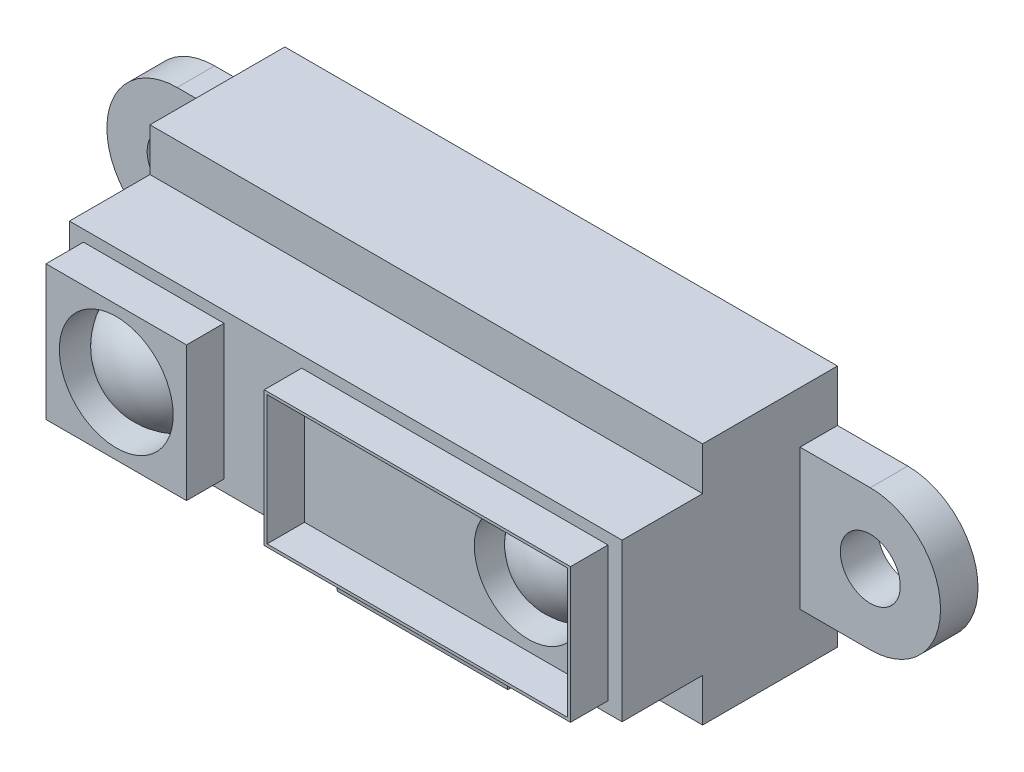
from build123d import *

# Parameters (mm, degrees)
ESTRUSIONE_ESTRUSIONE1_DEPTH = 4.5
NERVATURA1_START             = -4.55
NERVATURA1_DEPTH             = 9.1
ESTRUSIONE_ESTRUSIONE2_DEPTH = 7
TAGLIO_ESTRUSIONE1_DEPTH     = 3.3
ESTRUSIONE_ESTRUSIONE3_DEPTH = 2
FORO1_D                      = 3.2
FORO2_D                      = 3.2
SCHIZZO10_W                  = 29.5
SCHIZZO10_H                  = 2.3
SCHIZZO10_W_2                = 9.7
TAGLIO_ESTRUSIONE2_DEPTH     = 4.3
SCHIZZO11_W                  = 16.35
SCHIZZO11_H                  = 7.2
SCHIZZO11_W_2                = 16.05
SCHIZZO11_H_2                = 6.904461538
ESTRUSIONE_ESTRUSIONE4_DEPTH = 2
SCHIZZO12_R                  = 2.885572668
TAGLIO_ESTRUSIONE3_DEPTH     = 2
SCHIZZO15_W                  = 7.5
SCHIZZO15_H                  = 7.2
SCHIZZO15_R                  = 3.038054308
ESTRUSIONE_ESTRUSIONE5_DEPTH = 2


# Read off the part's stored shape, not the designer's step: Nervatura1
with BuildPart() as part:
    # Schizzo1 → Estrusione-Estrusione1 (new body)
    with BuildSketch(Plane.XY.offset(4.5)):
        Polygon((5.05, -9.992575631), (5.05, -6.5), (14.75, -6.5), (14.75, 6.5), (-14.75, 6.5), (-14.75, -6.5), (-5.05, -6.5), (-5.05, -9.992575631), align=None)
    extrude(amount=-ESTRUSIONE_ESTRUSIONE1_DEPTH)

    # Nervatura1 outline → Nervatura1 (add)
    with BuildSketch(Plane.YZ.offset(NERVATURA1_START)):
        Polygon((-4.296088186, 4.5), (-5.110000145, 7.951589572), (-9.866118458, 7.398410428), (-9.866118458, 4.5), align=None)
    extrude(amount=NERVATURA1_DEPTH)

    # Schizzo3 → Estrusione-Estrusione2 (add)
    with BuildSketch(Plane.XY.offset(4.5)):
        Polygon((-14.75, -6.5), (-14.75, 6.5), (14.75, 6.5), (14.75, -6.5), (5.05, -6.5), (5.05, -4.2), (-5.05, -4.2), (-5.05, -6.5), align=None)
    extrude(amount=ESTRUSIONE_ESTRUSIONE2_DEPTH)

    # Schizzo4 → Taglio-Estrusione1 (cut)
    with BuildSketch(Plane(origin=(0, 0, 0), x_dir=(-1, 0, 0), z_dir=(0, 0, -1))):
        Polygon((5.05, -9.992575631), (5.05, -6.5), (5.05, -6), (14.25, -6), (14.25, 6), (-14.25, 6), (-14.25, -6), (-5.05, -6), (-5.05, -6.5), (-5.05, -9.992575631), align=None)
    extrude(amount=-TAGLIO_ESTRUSIONE1_DEPTH, mode=Mode.SUBTRACT)

    # Schizzo5 → Estrusione-Estrusione3 (add)
    with BuildSketch(Plane(origin=(0, 0, 0), x_dir=(-1, 0, 0), z_dir=(0, 0, -1))):
        with BuildLine():
            Line((14.75, 3.75), (14.75, -3.75))
            Line((14.75, -3.75), (18.5, -3.75))
            ThreePointArc((18.5, -3.75), (22.25, 0), (18.5, 3.75))
            Line((18.5, 3.75), (14.75, 3.75))
        make_face()
        with BuildLine():
            Line((-14.75, -3.75), (-14.75, 3.75))
            Line((-14.75, 3.75), (-18.5, 3.75))
            ThreePointArc((-18.5, 3.75), (-22.25, 0), (-18.5, -3.75))
            Line((-18.5, -3.75), (-14.75, -3.75))
        make_face()
    extrude(amount=-ESTRUSIONE_ESTRUSIONE3_DEPTH)

    # Foro1 (through all)
    with Locations(Plane.XY.offset(2)):
        with Locations((18.5, 0)):
            Hole(FORO1_D / 2)

    # Foro2 (through all)
    with Locations(Plane.XY.offset(2)):
        with Locations((-18.5, 0)):
            Hole(FORO2_D / 2)

    # Schizzo10 → Taglio-Estrusione2 (cut)
    with BuildSketch(Plane.XY.offset(11.5)):
        with Locations((0, 5.35)):
            Rectangle(SCHIZZO10_W, SCHIZZO10_H)
        with Locations((9.9, -5.35)):
            Rectangle(SCHIZZO10_W_2, SCHIZZO10_H)
        with Locations((-9.9, -5.35)):
            Rectangle(SCHIZZO10_W_2, SCHIZZO10_H)
    extrude(amount=-TAGLIO_ESTRUSIONE2_DEPTH, mode=Mode.SUBTRACT)

    # Schizzo11 → Estrusione-Estrusione4 (add)
    with BuildSketch(Plane.XY.offset(11.5)):
        with Locations((5.825, 0)):
            Rectangle(SCHIZZO11_W, SCHIZZO11_H)
        with Locations((5.825, 0.002230769)):
            Rectangle(SCHIZZO11_W_2, SCHIZZO11_H_2, mode=Mode.SUBTRACT)
    extrude(amount=ESTRUSIONE_ESTRUSIONE4_DEPTH)

    # Schizzo12 → Taglio-Estrusione3 (cut)
    with BuildSketch(Plane.XY.offset(11.5)):
        with Locations(Location((9.75, 0, 0), (0, 0, 180))):
            Circle(SCHIZZO12_R)
    extrude(amount=-TAGLIO_ESTRUSIONE3_DEPTH, mode=Mode.SUBTRACT)

    # Schizzo13 → Rivoluzione1 (revolve)
    with BuildSketch(Plane(origin=(0, 0, 0), x_dir=(1, 0, 0), z_dir=(0, 1, 0)), mode=Mode.PRIVATE) as rivoluzione1_sk:
        with BuildLine():
            Line((12.635572668, -9.5), (9.75, -9.5))
            Line((9.75, -9.5), (9.75, -11.5))
            ThreePointArc((9.75, -11.5), (11.505457891, -10.951118249), (12.635572668, -9.5))
        make_face()
    revolve(rivoluzione1_sk.sketch.rotate(Axis((9.75, 0, 9.5), (0, 0, 1)), 180), axis=Axis((9.75, 0, 9.5), (0, 0, 1)))

    # Schizzo14 → Rivoluzione2 (revolve)
    with BuildSketch(Plane(origin=(0, 0, 0), x_dir=(1, 0, 0), z_dir=(0, 1, 0)), mode=Mode.PRIVATE) as rivoluzione2_sk:
        with BuildLine():
            Line((-7.211945692, -11.5), (-10.25, -11.5))
            Line((-10.25, -11.5), (-10.25, -13.5))
            ThreePointArc((-10.25, -13.5), (-8.431362187, -12.955116727), (-7.211945692, -11.5))
        make_face()
    revolve(rivoluzione2_sk.sketch.rotate(Axis((-10.25, 0, 11.5), (0, 0, 1)), 180), axis=Axis((-10.25, 0, 11.5), (0, 0, 1)))

    # Schizzo15 → Estrusione-Estrusione5 (add)
    with BuildSketch(Plane.XY.offset(11.5)):
        with Locations((-10.25, 0)):
            Rectangle(SCHIZZO15_W, SCHIZZO15_H)
        with Locations((-10.25, 0)):
            Circle(SCHIZZO15_R, mode=Mode.SUBTRACT)
    extrude(amount=ESTRUSIONE_ESTRUSIONE5_DEPTH)


solid = part.part
